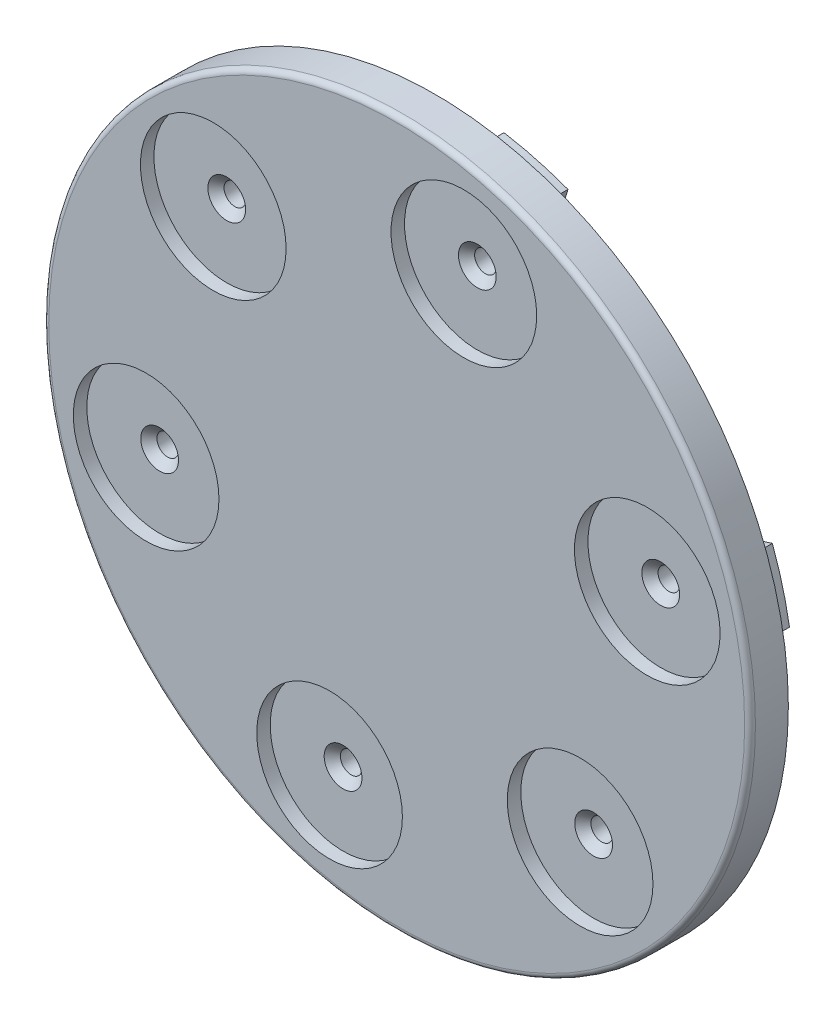
from build123d import *

# Parameters (mm, degrees)
SKETCH_1_R           = 1
EXTRUDE_1_DEPTH      = 9
EXTRUDE_2_DEPTH      = 0.2
EXTRUDE_2_DEPTH_BACK = 1
SKETCH_2_R           = 65.5
SKETCH_3_R           = 65.5
SKETCH_3_R_2         = 63.5
EXTRUDE_3_DEPTH      = 5.9
EXTRUDE_START        = -4
SKETCH_4_R           = 14.5
SKETCH_4_R_2         = 1
EXTRUDE_5_DEPTH      = 4
SKETCH_6_R           = 13.5
CUT_EXTRUDE_1_DEPTH  = 2.5
SKETCH_7_R           = 2
CUT_EXTRUDE_2_DEPTH  = 4
CHAMFER_1_SIZE       = 1.5
SKETCH_8_R           = 6.6
SKETCH_8_R_2         = 3.6
EXTRUDE_6_DEPTH      = 6
CHAMFER_2_SIZE       = 3
CHAMFER_3_SIZE       = 1
CUT_EXTRUDE_3_REACH  = 94.91
FILLET_4_R           = 1
FILLET_5_R           = 1
FILLET_6_R           = 1
EXTRUDE_7_DEPTH      = 5.9
CUT_EXTRUDE_4_DEPTH  = 10
EXTRUDE_8_DEPTH      = 0.25
FILLET_7_R           = 0.2
SKETCH_14_R          = 0.5
EXTRUDE_9_DEPTH      = 3
FILLET_9_R           = 1
CHAMFER_4_SIZE       = 1


with BuildPart() as part:
    # 草图1 → 凸台-拉伸1 (new body)
    with BuildSketch(Plane.XY):
        with BuildLine():
            Line((-30.451038239, 14.436906531), (-16.77922453, 10.746463922))
            ThreePointArc((-16.77922453, 10.746463922), (-16.325015328, 10.604315123), (-15.883496098, 10.426627052))
            ThreePointArc((-15.883496098, 10.426627052), (18.343472311, -4.951466811), (-18.972715991, -1.017864394))
            ThreePointArc((-18.972715991, -1.017864394), (-19.443676516, -0.949246142), (-19.907720092, -0.843530301))
            Line((-19.907720092, -0.843530301), (-33.579533801, 2.846912309))
            ThreePointArc((-33.579533801, 2.846912309), (-33.696625659, -0.476884887), (-33.485520759, -3.796037343))
            Line((-33.485520759, -3.796037343), (-63.608910859, -10.684402617))
            ThreePointArc((-63.608910859, -10.684402617), (-62.302215796, -16.693828409), (-60.42913402, -22.55149134))
            Line((-60.42913402, -22.55149134), (-30.946846706, -13.341014914))
            ThreePointArc((-30.946846706, -13.341014914), (-23.873491848, -23.785423834), (-13.455295606, -30.897330308))
            Line((-13.455295606, -30.897330308), (-22.55149134, -60.42913402))
            ThreePointArc((-22.55149134, -60.42913402), (-16.693828409, -62.302215796), (-10.684402617, -63.608910859))
            Line((-10.684402617, -63.608910859), (-3.919765525, -33.471262872))
            ThreePointArc((-3.919765525, -33.471262872), (8.662035356, -32.567762335), (20.030225152, -27.101292964))
            Line((20.030225152, -27.101292964), (41.05741952, -49.744731403))
            ThreePointArc((41.05741952, -49.744731403), (45.608387387, -45.608387387), (49.744731403, -41.05741952))
            Line((49.744731403, -41.05741952), (27.027081181, -20.130247958))
            ThreePointArc((27.027081181, -20.130247958), (32.535527204, -8.782338501), (33.485520759, 3.796037343))
            Line((33.485520759, 3.796037343), (63.608910859, 10.684402617))
            ThreePointArc((63.608910859, 10.684402617), (62.302215796, 16.693828409), (60.42913402, 22.55149134))
            Line((60.42913402, 22.55149134), (30.946846706, 13.341014914))
            ThreePointArc((30.946846706, 13.341014914), (23.873491848, 23.785423834), (13.455295606, 30.897330308))
            Line((13.455295606, 30.897330308), (22.55149134, 60.42913402))
            ThreePointArc((22.55149134, 60.42913402), (16.693828409, 62.302215796), (10.684402617, 63.608910859))
            Line((10.684402617, 63.608910859), (3.919765525, 33.471262872))
            ThreePointArc((3.919765525, 33.471262872), (-8.662035356, 32.567762335), (-20.030225152, 27.101292964))
            Line((-20.030225152, 27.101292964), (-41.05741952, 49.744731403))
            ThreePointArc((-41.05741952, 49.744731403), (-45.608387387, 45.608387387), (-49.744731403, 41.05741952))
            Line((-49.744731403, 41.05741952), (-27.027081181, 20.130247958))
            ThreePointArc((-27.027081181, 20.130247958), (-28.879700261, 17.368158015), (-30.451038239, 14.436906531))
        make_face()
        with Locations((-34, 34)):
            Circle(SKETCH_1_R, mode=Mode.SUBTRACT)
        with Locations((12.444863729, 46.444863729)):
            Circle(SKETCH_1_R, mode=Mode.SUBTRACT)
        with Locations((46.444863729, 12.444863729)):
            Circle(SKETCH_1_R, mode=Mode.SUBTRACT)
        with Locations((34, -34)):
            Circle(SKETCH_1_R, mode=Mode.SUBTRACT)
        with Locations((-12.444863729, -46.444863729)):
            Circle(SKETCH_1_R, mode=Mode.SUBTRACT)
        with Locations((-46.444863729, -12.444863729)):
            Circle(SKETCH_1_R, mode=Mode.SUBTRACT)
    extrude(amount=EXTRUDE_1_DEPTH)

    # 草图2 → 凸台-拉伸2 (add, two sides: drawn at the far end of the back side and taken through both)
    with BuildSketch(Plane.XY.offset(9).offset(-EXTRUDE_2_DEPTH_BACK)):
        Circle(SKETCH_2_R)
    extrude(amount=EXTRUDE_2_DEPTH + EXTRUDE_2_DEPTH_BACK)

    # 草图3 → 凸台-拉伸3 (add)
    with BuildSketch(Plane(origin=(0, 0, 8), x_dir=(-1, 0, 0), z_dir=(0, 0, -1))):
        Circle(SKETCH_3_R)
        Circle(SKETCH_3_R_2, mode=Mode.SUBTRACT)
    extrude(amount=EXTRUDE_3_DEPTH)

    # 草图4 → 凸台-拉伸5 (add)
    # profile 1 of 6: a face of its own
    with BuildSketch(Plane.XY.offset(9.2).offset(EXTRUDE_START)):
        with Locations((46.444863729, 12.444863729)):
            Circle(SKETCH_4_R)
        with Locations((46.444863729, 12.444863729)):
            Circle(SKETCH_4_R_2, mode=Mode.SUBTRACT)
    # profile 2 of 6: a face of its own
    with BuildSketch(Plane.XY.offset(9.2).offset(EXTRUDE_START)):
        with Locations((34, -34)):
            Circle(SKETCH_4_R)
        with Locations((34, -34)):
            Circle(SKETCH_4_R_2, mode=Mode.SUBTRACT)
    # profile 3 of 6: a face of its own
    with BuildSketch(Plane.XY.offset(9.2).offset(EXTRUDE_START)):
        with Locations((-12.444863729, -46.444863729)):
            Circle(SKETCH_4_R)
        with Locations((-12.444863729, -46.444863729)):
            Circle(SKETCH_4_R_2, mode=Mode.SUBTRACT)
    # profile 4 of 6: a face of its own
    with BuildSketch(Plane.XY.offset(9.2).offset(EXTRUDE_START)):
        with Locations((-46.444863729, -12.444863729)):
            Circle(SKETCH_4_R)
        with Locations((-46.444863729, -12.444863729)):
            Circle(SKETCH_4_R_2, mode=Mode.SUBTRACT)
    # profile 5 of 6: a face of its own
    with BuildSketch(Plane.XY.offset(9.2).offset(EXTRUDE_START)):
        with Locations((-34, 34)):
            Circle(SKETCH_4_R)
        with Locations((-34, 34)):
            Circle(SKETCH_4_R_2, mode=Mode.SUBTRACT)
    # profile 6 of 6: a face of its own
    with BuildSketch(Plane.XY.offset(9.2).offset(EXTRUDE_START)):
        with Locations((12.444863729, 46.444863729)):
            Circle(SKETCH_4_R)
        with Locations((12.444863729, 46.444863729)):
            Circle(SKETCH_4_R_2, mode=Mode.SUBTRACT)
    extrude(amount=EXTRUDE_5_DEPTH)

    # 草图6 → 切除-拉伸1 (cut)
    with BuildSketch(Plane.XY.offset(9.2)):
        with Locations((46.444863729, 12.444863729)):
            Circle(SKETCH_6_R)
        with Locations((34, -34)):
            Circle(SKETCH_6_R)
        with Locations((-12.444863729, -46.444863729)):
            Circle(SKETCH_6_R)
        with Locations((-46.444863729, -12.444863729)):
            Circle(SKETCH_6_R)
        with Locations((-34, 34)):
            Circle(SKETCH_6_R)
        with Locations((12.444863729, 46.444863729)):
            Circle(SKETCH_6_R)
    extrude(amount=-CUT_EXTRUDE_1_DEPTH, mode=Mode.SUBTRACT)

    # 草图7 → 切除-拉伸2 (cut)
    with BuildSketch(Plane.XY.offset(6.7)):
        with Locations((-34, 34)):
            Circle(SKETCH_7_R)
        with Locations((12.444863729, 46.444863729)):
            Circle(SKETCH_7_R)
        with Locations((46.444863729, 12.444863729)):
            Circle(SKETCH_7_R)
        with Locations((34, -34)):
            Circle(SKETCH_7_R)
        with Locations((-12.444863729, -46.444863729)):
            Circle(SKETCH_7_R)
        with Locations((-46.444863729, -12.444863729)):
            Circle(SKETCH_7_R)
    extrude(amount=-CUT_EXTRUDE_2_DEPTH, mode=Mode.SUBTRACT)

    # 倒角1
    chamfer_1_edges = [part.edges().sort_by_distance(p)[0] for p in [
        (-48.444863729, -12.444863729, 6.7),
        (-14.444863729, -46.444863729, 6.7),
        (32, -34, 6.7),
        (44.444863729, 12.444863729, 6.7),
        (10.444863729, 46.444863729, 6.7),
        (-36, 34, 6.7),
    ]]
    chamfer(chamfer_1_edges, length=CHAMFER_1_SIZE)

    # 草图8 → 凸台-拉伸6 (add)
    with BuildSketch(Plane(origin=(0, 0, 8), x_dir=(-1, 0, 0), z_dir=(0, 0, -1))):
        with Locations(Location((0, 0, 0), (0, 0, 180))):
            Circle(SKETCH_8_R)
        Circle(SKETCH_8_R_2, mode=Mode.SUBTRACT)
    extrude(amount=EXTRUDE_6_DEPTH)

    # 倒角2
    chamfer_2_edges = [part.edges().sort_by_distance(p)[0] for p in [
        (-6.6, 0, 8),
    ]]
    chamfer(chamfer_2_edges, length=CHAMFER_2_SIZE)

    # 倒角3
    chamfer_3_edges = [part.edges().sort_by_distance(p)[0] for p in [
        (3.6, 0, 2),
    ]]
    chamfer(chamfer_3_edges, length=CHAMFER_3_SIZE)

    # 切除-拉伸3: up to this face of the body (flat: up to its plane)
    cut_extrude_3_end = Plane(part.part.faces().sort_by_distance((-24.272083767, 6.509652371, 8))[0])
    # 草图9 → 切除-拉伸3 (cut, up to the picked face)
    with BuildSketch(Plane(origin=(0, 0, 2), x_dir=(-1, 0, 0), z_dir=(0, 0, -1)), mode=Mode.PRIVATE) as cut_extrude_3_sk1:
        with BuildLine():
            Line((-0.456056154, 1.689530344), (16.972049891, 6.393911674))
            ThreePointArc((16.972049891, 6.393911674), (19.117636389, 5.160437483), (17.884162198, 3.014850985))
            Line((17.884162198, 3.014850985), (0.456056154, -1.689530344))
            ThreePointArc((0.456056154, -1.689530344), (-1.689530344, -0.456056154), (-0.456056154, 1.689530344))
        make_face()
    cut_extrude_3_tool1 = split(extrude(cut_extrude_3_sk1.sketch, amount=-CUT_EXTRUDE_3_REACH, mode=Mode.PRIVATE), bisect_by=cut_extrude_3_end, keep=Keep.BOTH, mode=Mode.PRIVATE)
    add(cut_extrude_3_tool1.solids().sort_by(Axis((-8.714053, 2.352191, 2), (0, 0, 1)))[0], mode=Mode.SUBTRACT)

    # 圆角4
    fillet_4_edges = [part.edges().sort_by_distance(p)[0] for p in [
        (6.371943013, -1.719983208, 2),
    ]]
    fillet(fillet_4_edges, radius=FILLET_4_R)

    # 圆角5
    fillet_5_edges = [part.edges().sort_by_distance(p)[0] for p in [
        (49.677169622, -1.69027683, 5.2),
        (42.121047485, 26.285189342, 5.2),
        (23.374762137, -43.866829296, 5.2),
        (43.824165456, -23.335302485, 5.2),
        (-26.302407485, -42.176552466, 5.2),
        (1.703117971, -49.620491827, 5.2),
        (-49.677169622, 1.69027683, 5.2),
        (-42.121047485, -26.285189342, 5.2),
        (-23.374762137, 43.866829296, 5.2),
        (-43.824165456, 23.335302485, 5.2),
        (-1.703117971, 49.620491827, 5.2),
        (26.302407485, 42.176552466, 5.2),
    ]]
    fillet(fillet_5_edges, radius=FILLET_5_R)

    # 圆角6
    fillet_6_edges = [part.edges().sort_by_distance(p)[0] for p in [
        (-65.5, 0, 9.2),
    ]]
    fillet(fillet_6_edges, radius=FILLET_6_R)

    # 草图10 → 凸台-拉伸7 (add)
    with BuildSketch(Plane(origin=(0, 0, 8), x_dir=(-1, 0, 0), z_dir=(0, 0, -1))):
        with BuildLine():
            Line((59.271351784, 22.785013885), (62.685974923, 10.135015935))
            ThreePointArc((62.685974923, 10.135015935), (61.305815355, 16.548323288), (59.271351784, 22.785013885))
        make_face()
    extrude(amount=EXTRUDE_7_DEPTH)

    # 草图11 → 切除-拉伸4 (cut)
    with BuildSketch(Plane(origin=(-60.978663353, 16.46001491, 0), x_dir=(0, 0, -1), z_dir=(0.9654459111049437, -0.26060351634378504, 0))):
        with BuildLine():
            Line((-6.745266921, 3.47), (-6.745266921, -3.47))
            ThreePointArc((-6.745266921, -3.47), (-6.417226516, -4.261959595), (-5.625266921, -4.59))
            Line((-5.625266921, -4.59), (-4.474733079, -4.59))
            ThreePointArc((-4.474733079, -4.59), (-3.682773484, -4.261959595), (-3.354733079, -3.47))
            Line((-3.354733079, -3.47), (-3.354733079, 3.47))
            ThreePointArc((-3.354733079, 3.47), (-3.682773484, 4.261959595), (-4.474733079, 4.59))
            Line((-4.474733079, 4.59), (-5.625266921, 4.59))
            ThreePointArc((-5.625266921, 4.59), (-6.417226516, 4.261959595), (-6.745266921, 3.47))
        make_face()
    extrude(amount=-CUT_EXTRUDE_4_DEPTH, mode=Mode.SUBTRACT)

    # 草图12 → 凸台-拉伸8 (add)
    with BuildSketch(Plane(origin=(0, 0, 8), x_dir=(-1, 0, 0), z_dir=(0, 0, -1))):
        Polygon((59.271351784, 22.785013885), (41.796780793, 18.068090239), (45.211403932, 5.41809229), (62.685974923, 10.135015935), align=None)
    extrude(amount=EXTRUDE_8_DEPTH)

    # 圆角7
    fillet_7_edges = [part.edges().sort_by_distance(p)[0] for p in [
        (-61.992117337, 21.147751369, 6.417539695),
        (-61.885077927, 21.458963862, 5.05),
        (-61.992117343, 21.147751355, 3.682460322),
        (-63.236707177, 17.069530321, 3.354733079),
        (-64.213317372, 12.918973332, 3.682460305),
        (-64.277418207, 12.596170398, 5.05),
        (-64.21331737, 12.918973347, 6.417539678),
        (-63.236707177, 17.069530321, 6.745266921),
        (-59.867981696, 20.574706374, 6.417226516),
        (-60.978663353, 16.46001491, 6.745266921),
        (-62.08934501, 12.345323446, 6.417226516),
        (-62.174833493, 12.028618178, 5.05),
        (-62.08934501, 12.345323446, 3.682773484),
        (-60.978663353, 16.46001491, 3.354733079),
        (-59.867981696, 20.574706374, 3.682773484),
        (-59.782493213, 20.891411642, 5.05),
    ]]
    fillet(fillet_7_edges, radius=FILLET_7_R)

    # 草图14 → 凸台-拉伸9 (add)
    with BuildSketch(Plane(origin=(0, 0, 8), x_dir=(-1, 0, 0), z_dir=(0, 0, -1))):
        with BuildLine():
            Line((41.796780793, 18.068090239), (43.243488846, 12.708537175))
            ThreePointArc((43.243488846, 12.708537175), (44.469538273, 12.003694781), (43.764695878, 10.777645353))
            Line((43.764695878, 10.777645353), (45.211403932, 5.41809229))
            Line((45.211403932, 5.41809229), (43.676849843, 5.003868989))
            ThreePointArc((43.676849843, 5.003868989), (42.917847489, 5.102367036), (42.450800415, 5.708711384))
            Line((42.450800415, 5.708711384), (39.557384309, 16.427817511))
            ThreePointArc((39.557384309, 16.427817511), (39.655882356, 17.186819865), (40.262226704, 17.653866939))
            Line((40.262226704, 17.653866939), (41.796780793, 18.068090239))
        make_face()
        with Locations(Location((43.504092362, 11.743091264, 0), (0, 0, 105.105875673))):
            Circle(SKETCH_14_R, mode=Mode.SUBTRACT)
    extrude(amount=EXTRUDE_9_DEPTH)

    # 圆角9
    fillet_9_edges = [part.edges().sort_by_distance(p)[0] for p in [
        (-33.579533801, 2.846912309, 4),
        (-18.972715991, -1.017864394, 4),
        (-15.883496098, 10.426627052, 4),
        (-30.451038239, 14.436906531, 4),
        (-28.879700261, 17.368158015, 8),
        (-23.615131384, 12.591685226, 8),
        (-16.325015328, 10.604315123, 8),
        (18.343472311, -4.951466811, 8),
        (-19.443676516, -0.949246142, 8),
        (-26.743626947, 1.001691004, 8),
        (-33.696625659, -0.476884887, 8),
    ]]
    fillet(fillet_9_edges, radius=FILLET_9_R)

    # 倒角4
    # the kernel refuses this chamfer: 1 mm, written as the material it adds along each edge
    with BuildSketch(Plane(origin=(-40.52283022, 16.688421028, 8), x_dir=(0.965445911104944, -0.2606035163437835, 0), z_dir=(-0.2606035163437835, -0.965445911104944, 0))) as chamfer_4_piece_1_section:
        Polygon((1, -CHAMFER_4_SIZE), (1 + CHAMFER_4_SIZE, 0), (1, 0), align=None)
    chamfer_4_piece_1 = revolve(axis=Axis((-40.52283022, 16.688421028, 8), (0, 0, 1)), revolution_arc=237.405771779, mode=Mode.PRIVATE)
    chamfer_4_piece_1 = split(chamfer_4_piece_1, bisect_by=Plane(origin=(-41.858270084, 17.840293676, 7.43050613), z_dir=(0.9654459111049445, -0.26060351634378165, 0)), keep=Keep.TOP, mode=Mode.PRIVATE)
    add(chamfer_4_piece_1)
    with BuildSketch(Plane(origin=(-40.52283022, 16.688421028, 8), x_dir=(0.965445911104944, -0.2606035163437835, 0), z_dir=(-0.2606035163437835, -0.965445911104944, 0))) as chamfer_4_piece_2_section:
        Polygon((1, -CHAMFER_4_SIZE), (1 + CHAMFER_4_SIZE, 0), (1, 0), align=None)
    chamfer_4_piece_2 = revolve(axis=Axis((-40.52283022, 16.688421028, 8), (0, 0, 1)), revolution_arc=237.405771779, mode=Mode.PRIVATE)
    chamfer_4_piece_2 = split(chamfer_4_piece_2, bisect_by=Plane(origin=(-41.831870291, 18.077561973, 7.969312725), z_dir=(0.260603516343779, 0.9654459111049453, 0)), keep=Keep.TOP, mode=Mode.PRIVATE)
    add(chamfer_4_piece_2)
    with BuildSketch(Plane(origin=(-42.450800415, 5.708711384, 8), x_dir=(-0.026545781645936163, 0.007165522129673398, -0.9996219169112968), z_dir=(0.26060351634378137, 0.9654459111049446, 0))) as chamfer_4_piece_3:
        Polygon((CHAMFER_4_SIZE * 0.999621916911, -CHAMFER_4_SIZE * 0.0274958766106), (-CHAMFER_4_SIZE * 0.0274958766106, -CHAMFER_4_SIZE * 0.999621916911), (0, 0), align=None)
    extrude(amount=11.102751593)
    with BuildSketch(Plane(origin=(-43.416246326, 5.9693149, 8), x_dir=(-0.30051191560473467, 0.9537780604415121, 0), z_dir=(0.9537780604415121, 0.30051191560473467, 0))) as chamfer_4_piece_4_section:
        Polygon((1, -CHAMFER_4_SIZE), (1 + CHAMFER_4_SIZE, 0), (1, 0), align=None)
    chamfer_4_piece_4 = revolve(axis=Axis((-43.416246326, 5.9693149, 8), (0, 0, 1)), revolution_arc=237.405771779, mode=Mode.PRIVATE)
    chamfer_4_piece_4 = split(chamfer_4_piece_4, bisect_by=Plane(origin=(-45.26971809, 5.202058498, 7.53875915), z_dir=(0.9654459111049443, -0.26060351634378276, 0)), keep=Keep.TOP, mode=Mode.PRIVATE)
    add(chamfer_4_piece_4)
    with BuildSketch(Plane(origin=(-43.416246326, 5.9693149, 8), x_dir=(-0.30051191560473467, 0.9537780604415121, 0), z_dir=(0.9537780604415121, 0.30051191560473467, 0))) as chamfer_4_piece_5_section:
        Polygon((1, -CHAMFER_4_SIZE), (1 + CHAMFER_4_SIZE, 0), (1, 0), align=None)
    chamfer_4_piece_5 = revolve(axis=Axis((-43.416246326, 5.9693149, 8), (0, 0, 1)), revolution_arc=237.405771779, mode=Mode.PRIVATE)
    chamfer_4_piece_5 = split(chamfer_4_piece_5, bisect_by=Plane(origin=(-45.260844018, 5.374400056, 7.75), z_dir=(0, 0, 1)), keep=Keep.TOP, mode=Mode.PRIVATE)
    add(chamfer_4_piece_5)


solid = part.part
